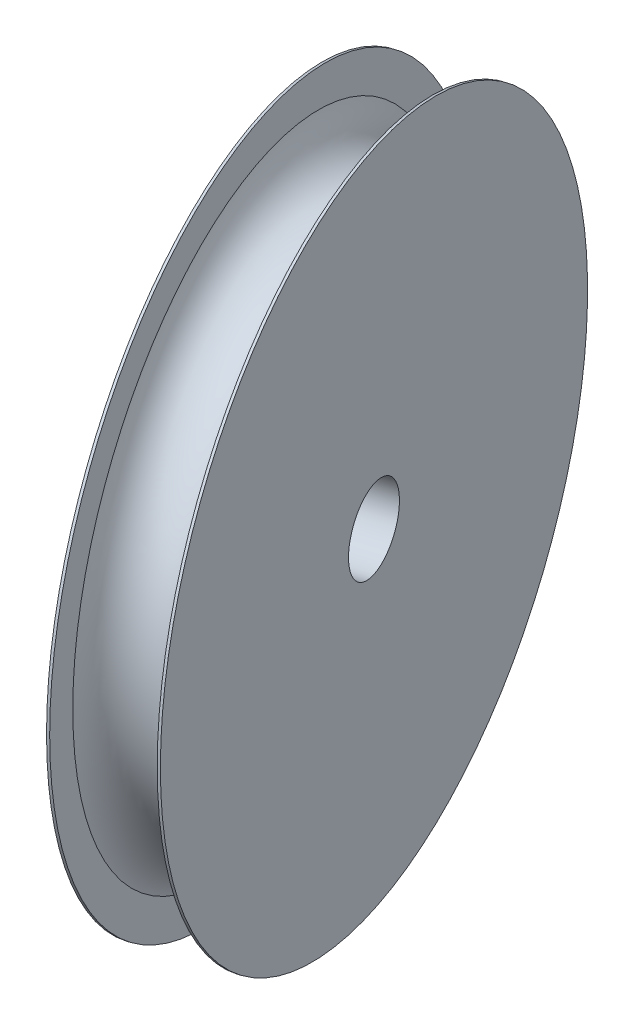
from build123d import *


with BuildPart() as part:
    # Sketch1 → Revolve1 (revolve)
    with BuildSketch(Plane(origin=(24.944783948, 0, 78.15610893), x_dir=(-0.9526544627837796, -1.850633615924126e-15, 0.3040550518214558), z_dir=(-0.3040550518214558, 0, -0.9526544627837796))):
        with BuildLine():
            Line((107.604108592, -107.58825896), (103.794108592, -107.58825896))
            Line((103.794108592, -107.58825896), (103.794108592, -95.38825896))
            Line((103.794108592, -95.38825896), (103.899108592, -95.38825896))
            Line((103.899108592, -95.38825896), (103.899108592, -96.88825896))
            ThreePointArc((103.899108592, -96.88825896), (105.699108592, -98.200028656), (107.499108592, -96.88825896))
            Line((107.499108592, -96.88825896), (107.499108592, -95.38825896))
            Line((107.499108592, -95.38825896), (107.604108592, -95.38825896))
            Line((107.604108592, -95.38825896), (107.604108592, -107.58825896))
        make_face()
    revolve(axis=Axis((-81.573765968, -109.23825896, 112.153223813), (0.9526544627837797, 1.1350566323106069e-15, -0.30405505182145554)))


solid = part.part
